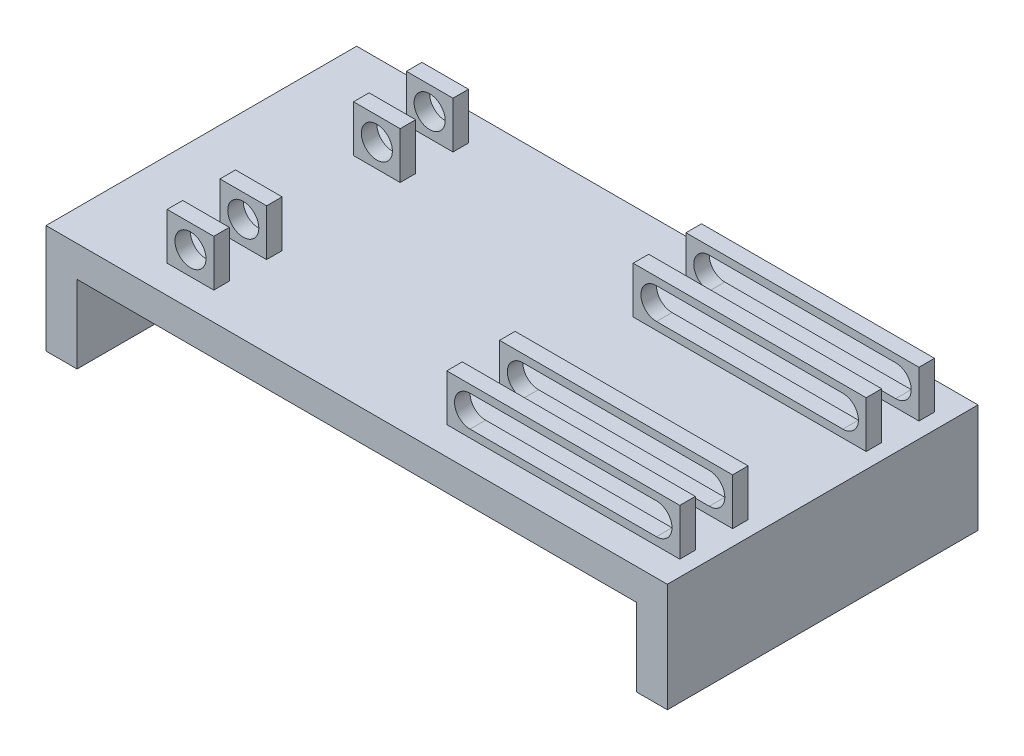
from build123d import *

# Parameters (mm, degrees)
SKETCH1_W               = 200
SKETCH1_H               = 100
SKETCH1_W_2             = 75
SKETCH1_H_2             = 5
SKETCH1_W_3             = 15
BOSS_EXTRUDE2_DEPTH     = 10
SKETCH1_8_W             = 75
SKETCH1_8_H             = 5
SKETCH1_8_W_2           = 15
BOSS_EXTRUDE3_DEPTH     = 25
SKETCH5_W               = 10
SKETCH5_H               = 100
BOSS_EXTRUDE4_DEPTH     = 25
CUT_EXTRUDE2_DEPTH      = 125.040316027
CUT_EXTRUDE2_DEPTH_BACK = 125.040316027
SKETCH7_R               = 5
CUT_EXTRUDE3_DEPTH      = 138.499090906


with BuildPart() as part:
    # Sketch1 → Boss-Extrude2 (new body)
    with BuildSketch(Plane(origin=(0, 0, 0), x_dir=(1, 0, 0), z_dir=(0, 1, 0))):
        Rectangle(SKETCH1_W, SKETCH1_H)
        with Locations((57.5, -38.5)):
            Rectangle(SKETCH1_W_2, SKETCH1_H_2, mode=Mode.SUBTRACT)
        with Locations((-62.5, -38.5)):
            Rectangle(SKETCH1_W_3, SKETCH1_H_2, mode=Mode.SUBTRACT)
        with Locations((-62.5, -21.5)):
            Rectangle(SKETCH1_W_3, SKETCH1_H_2, mode=Mode.SUBTRACT)
        with Locations((57.5, -21.5)):
            Rectangle(SKETCH1_W_2, SKETCH1_H_2, mode=Mode.SUBTRACT)
        with Locations((57.5, 21.5)):
            Rectangle(SKETCH1_W_2, SKETCH1_H_2, mode=Mode.SUBTRACT)
        with Locations((57.5, 38.5)):
            Rectangle(SKETCH1_W_2, SKETCH1_H_2, mode=Mode.SUBTRACT)
        with Locations((-62.5, 38.5)):
            Rectangle(SKETCH1_W_3, SKETCH1_H_2, mode=Mode.SUBTRACT)
        with Locations((-62.5, 21.5)):
            Rectangle(SKETCH1_W_3, SKETCH1_H_2, mode=Mode.SUBTRACT)
    extrude(amount=BOSS_EXTRUDE2_DEPTH)

    # Sketch1<8> → Boss-Extrude3 (add)
    with BuildSketch(Plane(origin=(0, 0, 0), x_dir=(1, 0, 0), z_dir=(0, 1, 0))):
        with Locations((57.5, -38.5)):
            Rectangle(SKETCH1_8_W, SKETCH1_8_H)
        with Locations((-62.5, -38.5)):
            Rectangle(SKETCH1_8_W_2, SKETCH1_8_H)
        with Locations((-62.5, -21.5)):
            Rectangle(SKETCH1_8_W_2, SKETCH1_8_H)
        with Locations((57.5, -21.5)):
            Rectangle(SKETCH1_8_W, SKETCH1_8_H)
        with Locations((57.5, 21.5)):
            Rectangle(SKETCH1_8_W, SKETCH1_8_H)
        with Locations((57.5, 38.5)):
            Rectangle(SKETCH1_8_W, SKETCH1_8_H)
        with Locations((-62.5, 38.5)):
            Rectangle(SKETCH1_8_W_2, SKETCH1_8_H)
        with Locations((-62.5, 21.5)):
            Rectangle(SKETCH1_8_W_2, SKETCH1_8_H)
    extrude(amount=BOSS_EXTRUDE3_DEPTH)

    # Sketch5 → Boss-Extrude4 (add)
    with BuildSketch(Plane.XZ):
        with Locations((-95, 0)):
            Rectangle(SKETCH5_W, SKETCH5_H)
        with Locations((95, 0)):
            Rectangle(SKETCH5_W, SKETCH5_H)
    extrude(amount=BOSS_EXTRUDE4_DEPTH)

    # Sketch7 → Cut-Extrude2 (cut, two sides: drawn at the far end of the back side and taken through both)
    with BuildSketch(Plane(origin=(0, 0, 19), x_dir=(-1, 0, 0), z_dir=(0, 0, -1)).offset(-CUT_EXTRUDE2_DEPTH_BACK)):
        with Locations((62.5, 17.5)):
            Circle(SKETCH7_R)
    extrude(amount=CUT_EXTRUDE2_DEPTH + CUT_EXTRUDE2_DEPTH_BACK, mode=Mode.SUBTRACT)

    # Sketch8 → Cut-Extrude3 (cut, through all)
    with BuildSketch(Plane.XY.offset(41)):
        with BuildLine():
            Line((27.5, 22.5), (87.5, 22.5))
            ThreePointArc((87.5, 22.5), (92.5, 17.5), (87.5, 12.5))
            Line((87.5, 12.5), (27.5, 12.5))
            ThreePointArc((27.5, 12.5), (22.5, 17.5), (27.5, 22.5))
        make_face()
    extrude(amount=-CUT_EXTRUDE3_DEPTH, mode=Mode.SUBTRACT)


solid = part.part
